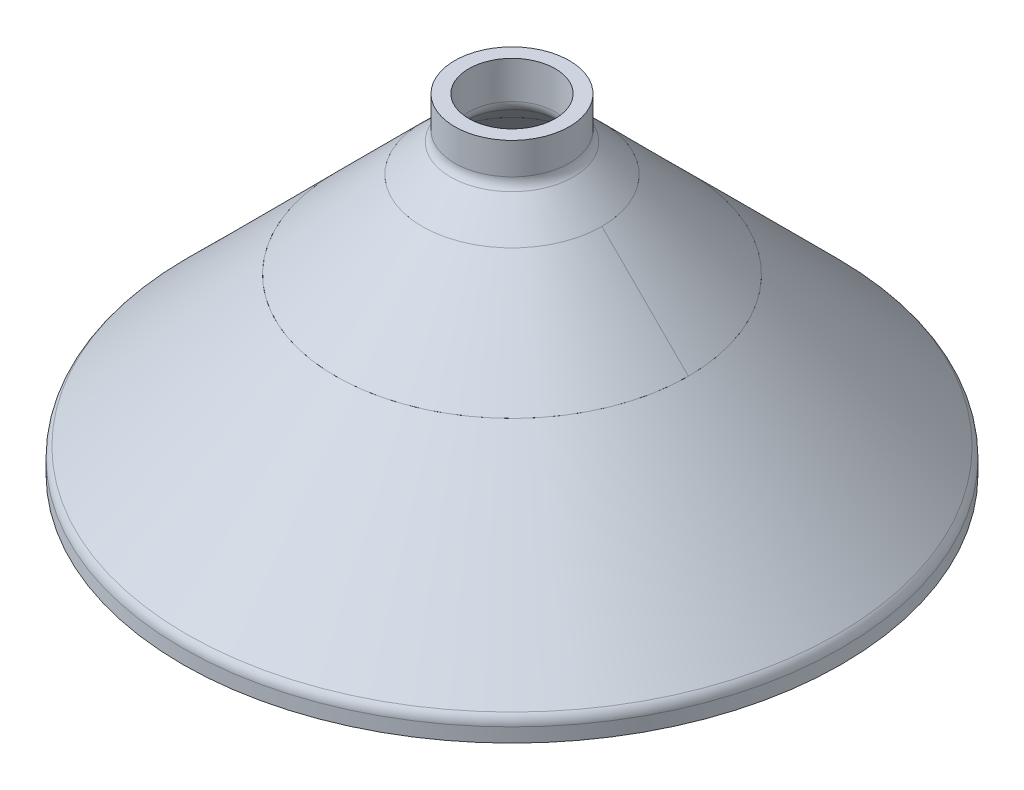
from build123d import *

# Parameters (mm, degrees)
FILLET1_R = 3.25
FILLET2_R = 3.25
FILLET3_R = 3.25
FILLET4_R = 3.25


# Read off the part's stored shape, not the designer's step: Split2, Split3
with BuildPart() as part:
    # Sketch2 → Revolve1 (revolve)
    with BuildSketch(Plane.XY, mode=Mode.PRIVATE) as revolve1_sk:
        Polygon((-76.2, 4.596194078), (-76.2, 0), (-72.95, 0), (-72.95, 3.25), (-10, 66.2), (-10, 70.796194078), (-10, 76.2), (-13.25, 76.2), (-13.25, 67.546194078), align=None)
    revolve(revolve1_sk.sketch.rotate(Axis((0, 0, 0), (0, 1, 0)), 180), axis=Axis((0, 0, 0), (0, 1, 0)))

    # Fillet1
    fillet1_edges = [part.edges().sort_by_distance(p)[0] for p in [
        (-76.2, 4.596194078, 0),
    ]]
    fillet(fillet1_edges, radius=FILLET1_R)

    # Fillet2
    fillet2_edges = [part.edges().sort_by_distance(p)[0] for p in [
        (-72.95, 3.25, 0),
    ]]
    fillet(fillet2_edges, radius=FILLET2_R)

    # Fillet3
    fillet3_edges = [part.edges().sort_by_distance(p)[0] for p in [
        (-13.25, 67.546194078, 0),
    ]]
    fillet(fillet3_edges, radius=FILLET3_R)

    # Fillet4
    fillet4_edges = [part.edges().sort_by_distance(p)[0] for p in [
        (-10, 66.2, 0),
    ]]
    fillet(fillet4_edges, radius=FILLET4_R)


with BuildPart() as body_2:
    # Split1: the piece on the far side of the plane
    add(part.part)
    split(bisect_by=Plane.ZX.offset(40), keep=Keep.BOTTOM)


with BuildPart() as part_1:
    add(part.part)

    # Split1
    split(bisect_by=Plane.ZX.offset(40), keep=Keep.TOP)


with BuildPart() as body_3:
    # Split2: the piece on the far side of the plane
    add(part_1.part)
    split(bisect_by=Plane(origin=(0, 60, 0), x_dir=(1, 0, 0), z_dir=(0, 1, 0)), keep=Keep.BOTTOM)


with BuildPart() as part_2:
    add(part_1.part)

    # Split2
    split(bisect_by=Plane(origin=(0, 60, 0), x_dir=(1, 0, 0), z_dir=(0, 1, 0)), keep=Keep.TOP)


with BuildPart() as body_4:
    # Split3: the piece on the far side of the plane
    add(body_3.part)
    split(bisect_by=Plane.XY, keep=Keep.BOTTOM)


with BuildPart() as body_3_1:
    add(body_3.part)

    # Split3
    split(bisect_by=Plane.XY, keep=Keep.TOP)


solid = Compound([body_2.part, part_2.part, body_4.part, body_3_1.part])
